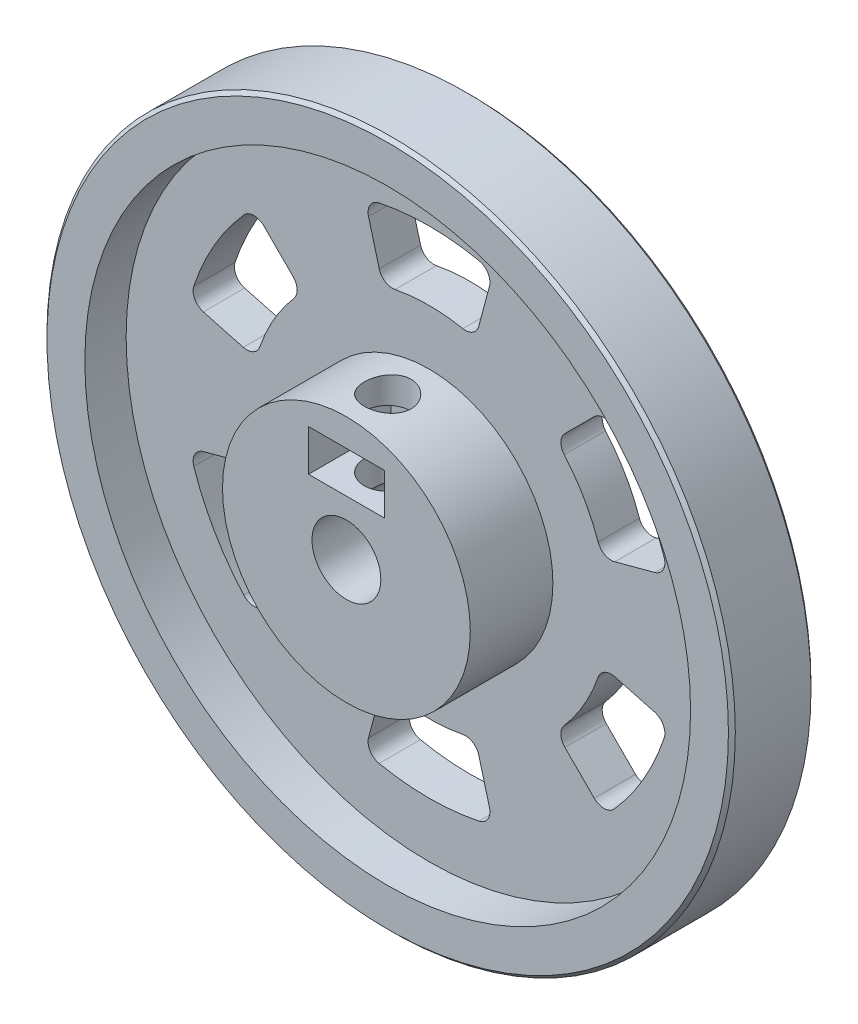
from build123d import *

# Parameters (mm, degrees)
SKETCH1_R               = 25
BOSS_EXTRUDE1_DEPTH     = 3
SKETCH3_R               = 25
SKETCH3_R_2             = 22
BOSS_EXTRUDE3_DEPTH     = 6
SKETCH4_R               = 9
BOSS_EXTRUDE4_DEPTH     = 9
SKETCH5_R               = 2.5
CUT_EXTRUDE1_DEPTH      = 37.482872694
SKETCH6_W               = 5.5
SKETCH6_H               = 3
CUT_EXTRUDE2_DEPTH      = 6
CUT_EXTRUDE3_REACH      = 38.483
CUT_EXTRUDE3_END_RADIUS = 9
SKETCH7_R               = 1.7
CUT_EXTRUDE4_DEPTH      = 37.482872719
CIRPATTERN1_COUNT       = 6
CHAMFER1_SIZE           = 0.25


with BuildPart() as part:
    # Sketch1 → Boss-Extrude1 (new body)
    with BuildSketch(Plane.XY):
        Circle(SKETCH1_R)
    extrude(amount=BOSS_EXTRUDE1_DEPTH)

    # Sketch3 → Boss-Extrude3 (add)
    with BuildSketch(Plane.XY):
        Circle(SKETCH3_R)
        Circle(SKETCH3_R_2, mode=Mode.SUBTRACT)
    extrude(amount=BOSS_EXTRUDE3_DEPTH)

    # Sketch4 → Boss-Extrude4 (add)
    with BuildSketch(Plane.XY):
        Circle(SKETCH4_R)
    extrude(amount=BOSS_EXTRUDE4_DEPTH)

    # Sketch5 → Cut-Extrude1 (cut, through all)
    with BuildSketch(Plane.XY):
        Circle(SKETCH5_R)
    extrude(amount=CUT_EXTRUDE1_DEPTH, mode=Mode.SUBTRACT)

    # Sketch6 → Cut-Extrude2 (cut)
    with BuildSketch(Plane.XY.offset(9)):
        with Locations((0, 5.5)):
            Rectangle(SKETCH6_W, SKETCH6_H)
    extrude(amount=-CUT_EXTRUDE2_DEPTH, mode=Mode.SUBTRACT)

    # Cut-Extrude3: up to this cylinder (the profile starts inside it)
    cut_extrude3_end = Plane(origin=(0, 0, 6), z_dir=(0, 0, -1)) * Cylinder(CUT_EXTRUDE3_END_RADIUS, 95.966, mode=Mode.PRIVATE)
    # Sketch7 → Cut-Extrude3 (cut, up to the surface)
    with BuildSketch(Plane(origin=(0, 0, 0), x_dir=(1, 0, 0), z_dir=(0, 1, 0)), mode=Mode.PRIVATE) as cut_extrude3_sk1:
        with Locations((0, -6)):
            Circle(SKETCH7_R)
    cut_extrude3_tool1 = extrude(cut_extrude3_sk1.sketch, amount=CUT_EXTRUDE3_REACH, mode=Mode.PRIVATE) & cut_extrude3_end
    add(cut_extrude3_tool1.solids().sort_by_distance((0, 0, 6))[0], mode=Mode.SUBTRACT)

    # Sketch8 → Cut-Extrude4 (cut, through all)
    with BuildSketch(Plane.XY):
        with BuildLine():
            Line((-4.392304845, 16.392304845), (-3.614211274, 13.488420103))
            ThreePointArc((-3.614211274, 13.488420103), (-3.178915308, 12.899635496), (-2.459122201, 12.765293494))
            ThreePointArc((-2.459122201, 12.765293494), (0, 13), (2.459122201, 12.765293494))
            ThreePointArc((2.459122201, 12.765293494), (3.178915308, 12.899635496), (3.614211274, 13.488420103))
            Line((3.614211274, 13.488420103), (4.392304845, 16.392304845))
            ThreePointArc((4.392304845, 16.392304845), (4.277317186, 17.176389762), (3.627930726, 17.630601766))
            ThreePointArc((3.627930726, 17.630601766), (0, 18), (-3.627930726, 17.630601766))
            ThreePointArc((-3.627930726, 17.630601766), (-4.277317186, 17.176389762), (-4.392304845, 16.392304845))
        make_face()
    cut_extrude4 = extrude(amount=CUT_EXTRUDE4_DEPTH, mode=Mode.SUBTRACT)

    # CirPattern1: Cut-Extrude4 ×6 about axis
    cirpattern1_axis = Axis((0, 0, 9), (0, 0, 1))
    for i in range(1, CIRPATTERN1_COUNT):
        add(cut_extrude4.rotate(cirpattern1_axis, i * 360 / CIRPATTERN1_COUNT), mode=Mode.SUBTRACT)

    # Chamfer1
    chamfer1_edges = [part.edges().sort_by_distance(p)[0] for p in [
        (-25, 0, 6),
        (-25, 0, 0),
    ]]
    chamfer(chamfer1_edges, length=CHAMFER1_SIZE)


solid = part.part
